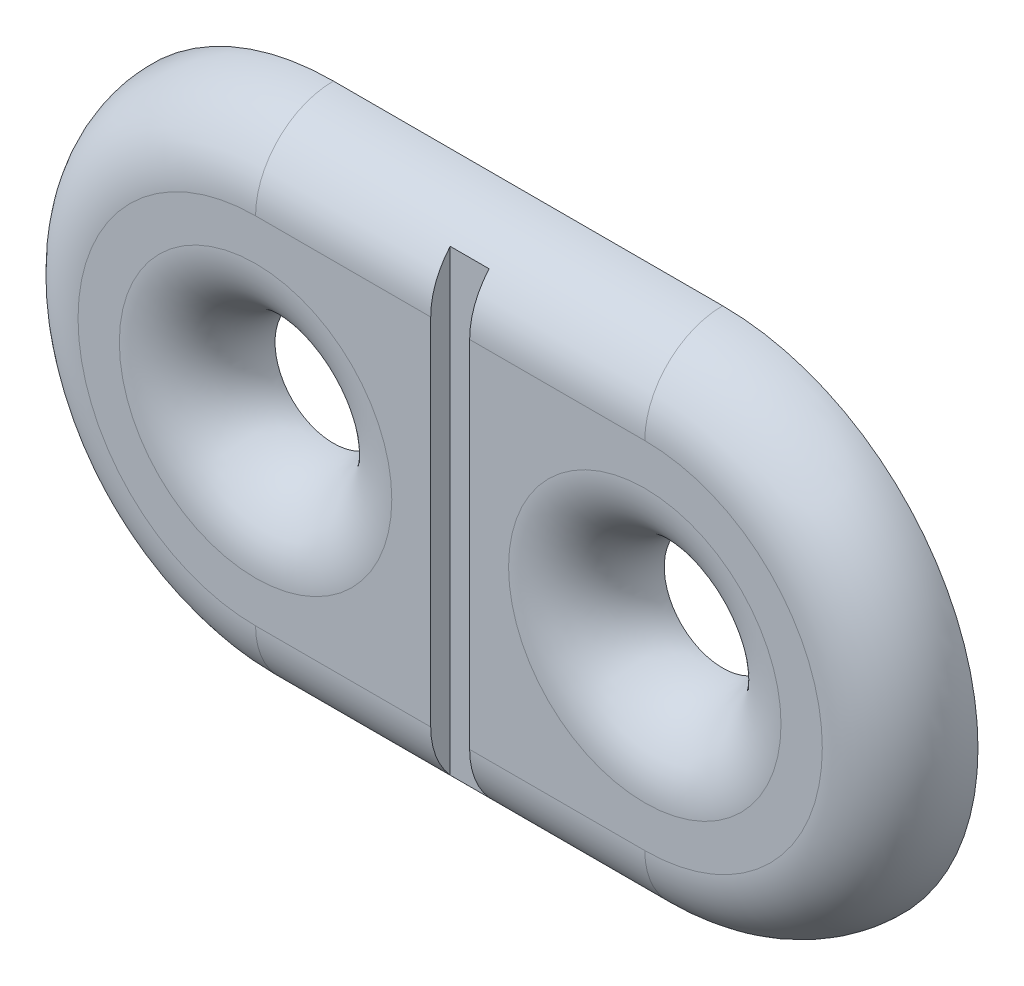
from build123d import *

# Parameters (mm, degrees)
SKETCH_1_R          = 1.5
EXTRUDE_1_DEPTH     = 2
FILLET_1_R          = 2
SKETCH_2_W          = 1
SKETCH_2_H          = 1
CUT_EXTRUDE_1_DEPTH = 50


with BuildPart() as part:
    # 草图1 → 凸台-拉伸1 (new body)
    with BuildSketch(Plane.XY):
        with BuildLine():
            Line((0, 6.560739839), (10, 6.560739839))
            ThreePointArc((10, 6.560739839), (16.560739839, 0), (10, -6.560739839))
            Line((10, -6.560739839), (0, -6.560739839))
            ThreePointArc((0, -6.560739839), (-6.560739839, 0), (0, 6.560739839))
        make_face()
        Circle(SKETCH_1_R, mode=Mode.SUBTRACT)
        with Locations((10, 0)):
            Circle(SKETCH_1_R, mode=Mode.SUBTRACT)
    extrude(amount=EXTRUDE_1_DEPTH)

    # 圆角1
    fillet_1_edges = [part.edges().sort_by_distance(p)[0] for p in [
        (8.5, 0, 2),
        (5, 6.560739839, 2),
        (16.560739839, 0, 2),
        (5, -6.560739839, 2),
        (-6.560739839, 0, 2),
        (-1.5, 0, 2),
    ]]
    fillet(fillet_1_edges, radius=FILLET_1_R - 0.0001)  # a hair under: the kernel refuses the full size

    # 草图2 → 切除-拉伸1 (cut, symmetric)
    with BuildSketch(Plane(origin=(0, 0, 0), x_dir=(1, 0, 0), z_dir=(0, 1, 0))):
        with Locations((5, -2)):
            Rectangle(SKETCH_2_W, SKETCH_2_H)
    extrude(amount=CUT_EXTRUDE_1_DEPTH, both=True, mode=Mode.SUBTRACT)


solid = part.part
